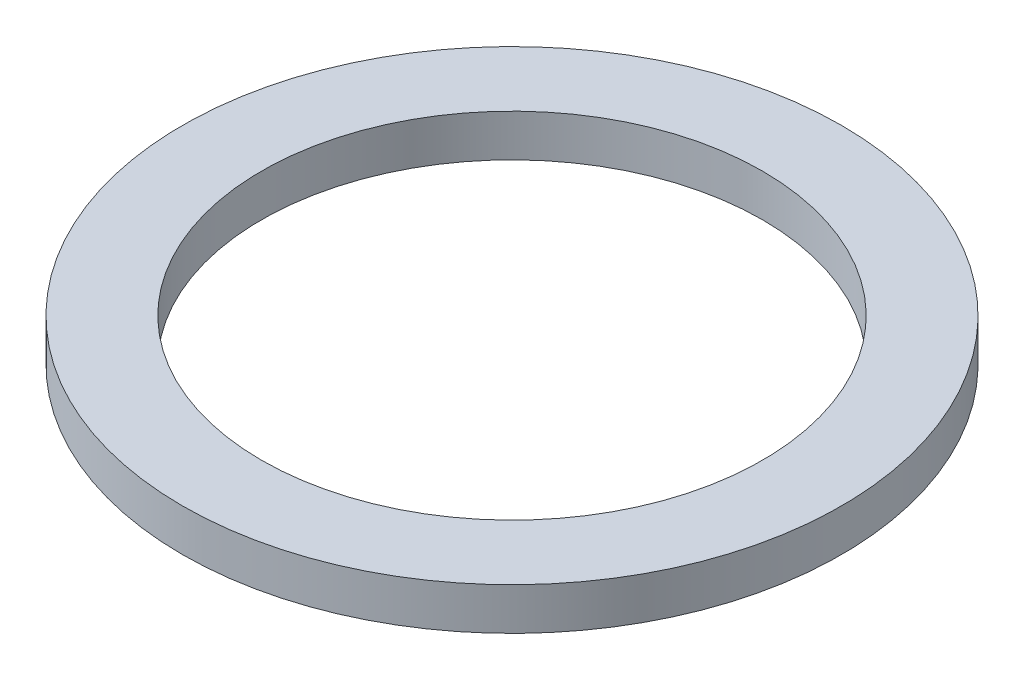
from build123d import *

# Parameters (mm, degrees)
SKETCH1_R           = 62.5
BOSS_EXTRUDE1_DEPTH = 8
SKETCH2_R           = 47.5
CUT_EXTRUDE1_DEPTH  = 89.749647887


with BuildPart() as part:
    # Sketch1 → Boss-Extrude1 (new body)
    with BuildSketch(Plane(origin=(0, 0, 0), x_dir=(1, 0, 0), z_dir=(0, 1, 0))):
        Circle(SKETCH1_R)
    extrude(amount=BOSS_EXTRUDE1_DEPTH)

    # Sketch2 → Cut-Extrude1 (cut, through all)
    with BuildSketch(Plane(origin=(0, 0, 0), x_dir=(1, 0, 0), z_dir=(0, 1, 0))):
        Circle(SKETCH2_R)
    extrude(amount=CUT_EXTRUDE1_DEPTH, mode=Mode.SUBTRACT)


solid = part.part
